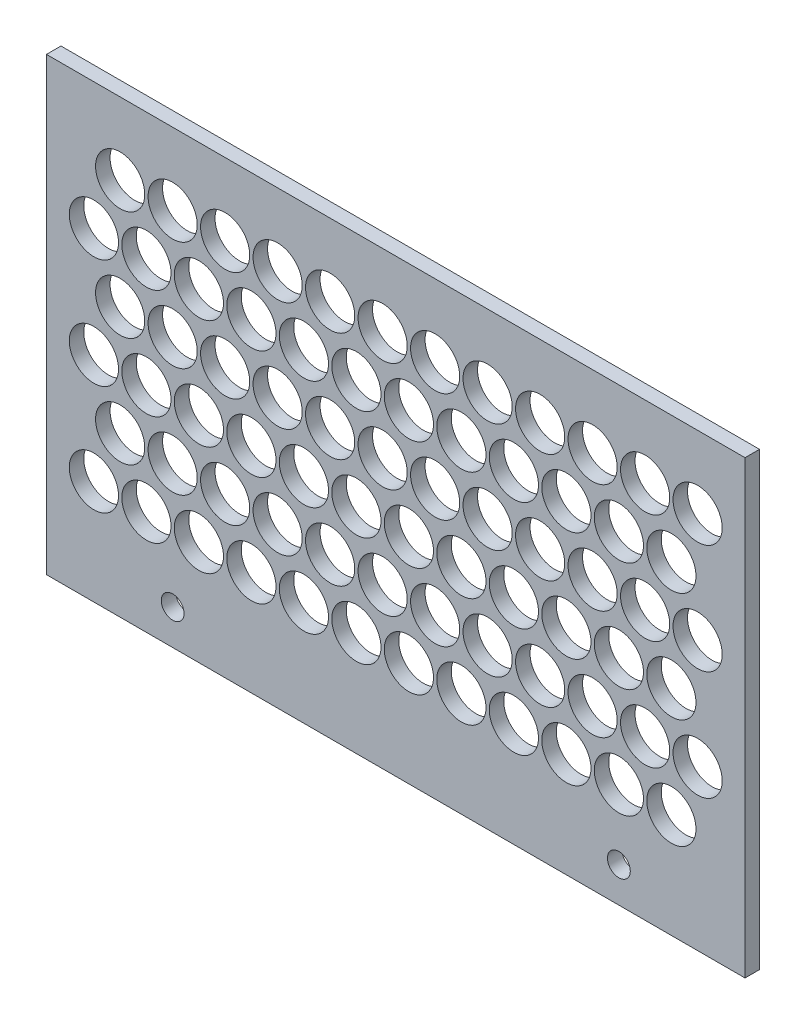
from build123d import *

# Parameters (mm, degrees)
SKETCH1_W                  = 306.05000007
SKETCH1_H                  = 197.4250001
BOSS_EXTRUDE1_DEPTH        = 6.35
CUT_EXTRUDE1_DEPTH         = 187.132543615
SKETCH4_R                  = 10.775
CUT_EXTRUDE2_DEPTH         = 187.132543615
LPATTERN1_COUNT            = 12
LPATTERN1_PITCH            = 23
LPATTERN2_COPY_1_DEPTH     = 187.132543615
LPATTERN2_COPY_2_DEPTH     = 187.132543615
LPATTERN2_COPY_3_DEPTH     = 187.132543615
LPATTERN2_COPY_4_DEPTH     = 187.132543615
LPATTERN2_COPY_5_DEPTH     = 187.132543615
LPATTERN2_COPY_6_DEPTH     = 187.132543615
LPATTERN2_COPY_7_DEPTH     = 187.132543615
LPATTERN2_COPY_8_DEPTH     = 187.132543615
LPATTERN2_COPY_9_DEPTH     = 187.132543615
LPATTERN2_COPY_10_DEPTH    = 187.132543615
LPATTERN2_COPY_11_DEPTH    = 187.132543615
LPATTERN2_COPY_12_DEPTH    = 187.132543615
LPATTERN2_COPY_13_DEPTH    = 187.132543615
LPATTERN2_COPY_14_DEPTH    = 187.132543615
LPATTERN2_COPY_15_DEPTH    = 187.132543615
LPATTERN2_COPY_16_DEPTH    = 187.132543615
LPATTERN2_COPY_17_DEPTH    = 187.132543615
LPATTERN2_COPY_18_DEPTH    = 187.132543615
LPATTERN2_COPY_19_DEPTH    = 187.132543615
LPATTERN2_COPY_20_DEPTH    = 187.132543615
LPATTERN2_COPY_21_DEPTH    = 187.132543615
LPATTERN2_COPY_22_DEPTH    = 187.132543615
LPATTERN2_COPY_23_SKETCH_R = 10.775
LPATTERN2_COPY_23_DEPTH    = 187.132543615
LPATTERN2_COPY_24_SKETCH_R = 10.775
LPATTERN2_COPY_24_DEPTH    = 187.132543615
LPATTERN2_COPY_25_SKETCH_R = 10.775
LPATTERN2_COPY_25_DEPTH    = 187.132543615
LPATTERN2_COPY_26_SKETCH_R = 10.775
LPATTERN2_COPY_26_DEPTH    = 187.132543615
LPATTERN2_COPY_27_SKETCH_R = 10.775
LPATTERN2_COPY_27_DEPTH    = 187.132543615
LPATTERN2_COPY_28_SKETCH_R = 10.775
LPATTERN2_COPY_28_DEPTH    = 187.132543615
LPATTERN2_COPY_29_SKETCH_R = 10.775
LPATTERN2_COPY_29_DEPTH    = 187.132543615
LPATTERN2_COPY_30_SKETCH_R = 10.775
LPATTERN2_COPY_30_DEPTH    = 187.132543615
LPATTERN2_COPY_31_SKETCH_R = 10.775
LPATTERN2_COPY_31_DEPTH    = 187.132543615
LPATTERN2_COPY_32_SKETCH_R = 10.775
LPATTERN2_COPY_32_DEPTH    = 187.132543615
LPATTERN2_COPY_33_SKETCH_R = 10.775
LPATTERN2_COPY_33_DEPTH    = 187.132543615
LPATTERN2_COPY_34_SKETCH_R = 10.775
LPATTERN2_COPY_34_DEPTH    = 187.132543615
LPATTERN2_COPY_35_SKETCH_R = 10.775
LPATTERN2_COPY_35_DEPTH    = 187.132543615
LPATTERN2_COPY_36_SKETCH_R = 10.775
LPATTERN2_COPY_36_DEPTH    = 187.132543615
LPATTERN2_COPY_37_SKETCH_R = 10.775
LPATTERN2_COPY_37_DEPTH    = 187.132543615
LPATTERN2_COPY_38_SKETCH_R = 10.775
LPATTERN2_COPY_38_DEPTH    = 187.132543615
LPATTERN2_COPY_39_SKETCH_R = 10.775
LPATTERN2_COPY_39_DEPTH    = 187.132543615
LPATTERN2_COPY_40_SKETCH_R = 10.775
LPATTERN2_COPY_40_DEPTH    = 187.132543615
LPATTERN2_COPY_41_SKETCH_R = 10.775
LPATTERN2_COPY_41_DEPTH    = 187.132543615
LPATTERN2_COPY_42_SKETCH_R = 10.775
LPATTERN2_COPY_42_DEPTH    = 187.132543615
LPATTERN2_COPY_43_SKETCH_R = 10.775
LPATTERN2_COPY_43_DEPTH    = 187.132543615
LPATTERN2_COPY_44_SKETCH_R = 10.775
LPATTERN2_COPY_44_DEPTH    = 187.132543615
LPATTERN2_COPY_45_DEPTH    = 187.132543615
LPATTERN2_COPY_46_DEPTH    = 187.132543615
LPATTERN2_COPY_47_SKETCH_R = 10.775
LPATTERN2_COPY_47_DEPTH    = 187.132543615
LPATTERN2_COPY_48_SKETCH_R = 10.775
LPATTERN2_COPY_48_DEPTH    = 187.132543615
SKETCH5_R                  = 5
CUT_EXTRUDE3_DEPTH         = 187.132543615


with BuildPart() as part:
    # Sketch1 → Boss-Extrude1 (new body)
    with BuildSketch(Plane.XY):
        with Locations((3.5e-08, -7.06250005)):
            Rectangle(SKETCH1_W, SKETCH1_H)
    extrude(amount=BOSS_EXTRUDE1_DEPTH)

    # Sketch3 → Cut-Extrude1 (cut, through all)
    with BuildSketch(Plane.XY.offset(6.35)):
        with BuildLine():
            ThreePointArc((-121.475, -60), (-132.24999993, -49.225), (-143.025, -59.999999859))
            ThreePointArc((-143.025, -59.999999859), (-139.869075617, -67.619075517), (-132.25, -70.775))
            ThreePointArc((-132.25, -70.775), (-124.630924433, -67.619075567), (-121.475, -60))
        make_face()
    cut_extrude1 = extrude(amount=-CUT_EXTRUDE1_DEPTH, mode=Mode.SUBTRACT)

    # Sketch4 → Cut-Extrude2 (cut, through all)
    with BuildSketch(Plane.XY.offset(6.35)):
        with Locations((-120.75, -36)):
            Circle(SKETCH4_R)
    cut_extrude2 = extrude(amount=-CUT_EXTRUDE2_DEPTH, mode=Mode.SUBTRACT)

    # LPattern1: Cut-Extrude1, Cut-Extrude2 ×12
    with Locations(*[(i * LPATTERN1_PITCH, 0, 0) for i in range(1, LPATTERN1_COUNT)]):
        add(cut_extrude1, mode=Mode.SUBTRACT)
        add(cut_extrude2, mode=Mode.SUBTRACT)

    # LPattern2 copy 1 sketch → LPattern2 copy 1 (cut, through all)
    with BuildSketch(Plane(origin=(23, 48, 6.35), x_dir=(1, 0, 0), z_dir=(0, 0, 1))):
        with BuildLine():
            ThreePointArc((-121.475, -60), (-132.24999993, -49.225), (-143.025, -59.999999859))
            ThreePointArc((-143.025, -59.999999859), (-139.869075617, -67.619075517), (-132.25, -70.775))
            ThreePointArc((-132.25, -70.775), (-124.630924433, -67.619075567), (-121.475, -60))
        make_face()
    extrude(amount=-LPATTERN2_COPY_1_DEPTH, mode=Mode.SUBTRACT)

    # LPattern2 copy 2 sketch → LPattern2 copy 2 (cut, through all)
    with BuildSketch(Plane(origin=(23, 96, 6.35), x_dir=(1, 0, 0), z_dir=(0, 0, 1))):
        with BuildLine():
            ThreePointArc((-121.475, -60), (-132.24999993, -49.225), (-143.025, -59.999999859))
            ThreePointArc((-143.025, -59.999999859), (-139.869075617, -67.619075517), (-132.25, -70.775))
            ThreePointArc((-132.25, -70.775), (-124.630924433, -67.619075567), (-121.475, -60))
        make_face()
    extrude(amount=-LPATTERN2_COPY_2_DEPTH, mode=Mode.SUBTRACT)

    # LPattern2 copy 3 sketch → LPattern2 copy 3 (cut, through all)
    with BuildSketch(Plane(origin=(46, 48, 6.35), x_dir=(1, 0, 0), z_dir=(0, 0, 1))):
        with BuildLine():
            ThreePointArc((-121.475, -60), (-132.24999993, -49.225), (-143.025, -59.999999859))
            ThreePointArc((-143.025, -59.999999859), (-139.869075617, -67.619075517), (-132.25, -70.775))
            ThreePointArc((-132.25, -70.775), (-124.630924433, -67.619075567), (-121.475, -60))
        make_face()
    extrude(amount=-LPATTERN2_COPY_3_DEPTH, mode=Mode.SUBTRACT)

    # LPattern2 copy 4 sketch → LPattern2 copy 4 (cut, through all)
    with BuildSketch(Plane(origin=(46, 96, 6.35), x_dir=(1, 0, 0), z_dir=(0, 0, 1))):
        with BuildLine():
            ThreePointArc((-121.475, -60), (-132.24999993, -49.225), (-143.025, -59.999999859))
            ThreePointArc((-143.025, -59.999999859), (-139.869075617, -67.619075517), (-132.25, -70.775))
            ThreePointArc((-132.25, -70.775), (-124.630924433, -67.619075567), (-121.475, -60))
        make_face()
    extrude(amount=-LPATTERN2_COPY_4_DEPTH, mode=Mode.SUBTRACT)

    # LPattern2 copy 5 sketch → LPattern2 copy 5 (cut, through all)
    with BuildSketch(Plane(origin=(69, 48, 6.35), x_dir=(1, 0, 0), z_dir=(0, 0, 1))):
        with BuildLine():
            ThreePointArc((-121.475, -60), (-132.24999993, -49.225), (-143.025, -59.999999859))
            ThreePointArc((-143.025, -59.999999859), (-139.869075617, -67.619075517), (-132.25, -70.775))
            ThreePointArc((-132.25, -70.775), (-124.630924433, -67.619075567), (-121.475, -60))
        make_face()
    extrude(amount=-LPATTERN2_COPY_5_DEPTH, mode=Mode.SUBTRACT)

    # LPattern2 copy 6 sketch → LPattern2 copy 6 (cut, through all)
    with BuildSketch(Plane(origin=(69, 96, 6.35), x_dir=(1, 0, 0), z_dir=(0, 0, 1))):
        with BuildLine():
            ThreePointArc((-121.475, -60), (-132.24999993, -49.225), (-143.025, -59.999999859))
            ThreePointArc((-143.025, -59.999999859), (-139.869075617, -67.619075517), (-132.25, -70.775))
            ThreePointArc((-132.25, -70.775), (-124.630924433, -67.619075567), (-121.475, -60))
        make_face()
    extrude(amount=-LPATTERN2_COPY_6_DEPTH, mode=Mode.SUBTRACT)

    # LPattern2 copy 7 sketch → LPattern2 copy 7 (cut, through all)
    with BuildSketch(Plane(origin=(92, 48, 6.35), x_dir=(1, 0, 0), z_dir=(0, 0, 1))):
        with BuildLine():
            ThreePointArc((-121.475, -60), (-132.24999993, -49.225), (-143.025, -59.999999859))
            ThreePointArc((-143.025, -59.999999859), (-139.869075617, -67.619075517), (-132.25, -70.775))
            ThreePointArc((-132.25, -70.775), (-124.630924433, -67.619075567), (-121.475, -60))
        make_face()
    extrude(amount=-LPATTERN2_COPY_7_DEPTH, mode=Mode.SUBTRACT)

    # LPattern2 copy 8 sketch → LPattern2 copy 8 (cut, through all)
    with BuildSketch(Plane(origin=(92, 96, 6.35), x_dir=(1, 0, 0), z_dir=(0, 0, 1))):
        with BuildLine():
            ThreePointArc((-121.475, -60), (-132.24999993, -49.225), (-143.025, -59.999999859))
            ThreePointArc((-143.025, -59.999999859), (-139.869075617, -67.619075517), (-132.25, -70.775))
            ThreePointArc((-132.25, -70.775), (-124.630924433, -67.619075567), (-121.475, -60))
        make_face()
    extrude(amount=-LPATTERN2_COPY_8_DEPTH, mode=Mode.SUBTRACT)

    # LPattern2 copy 9 sketch → LPattern2 copy 9 (cut, through all)
    with BuildSketch(Plane(origin=(115, 48, 6.35), x_dir=(1, 0, 0), z_dir=(0, 0, 1))):
        with BuildLine():
            ThreePointArc((-121.475, -60), (-132.24999993, -49.225), (-143.025, -59.999999859))
            ThreePointArc((-143.025, -59.999999859), (-139.869075617, -67.619075517), (-132.25, -70.775))
            ThreePointArc((-132.25, -70.775), (-124.630924433, -67.619075567), (-121.475, -60))
        make_face()
    extrude(amount=-LPATTERN2_COPY_9_DEPTH, mode=Mode.SUBTRACT)

    # LPattern2 copy 10 sketch → LPattern2 copy 10 (cut, through all)
    with BuildSketch(Plane(origin=(115, 96, 6.35), x_dir=(1, 0, 0), z_dir=(0, 0, 1))):
        with BuildLine():
            ThreePointArc((-121.475, -60), (-132.24999993, -49.225), (-143.025, -59.999999859))
            ThreePointArc((-143.025, -59.999999859), (-139.869075617, -67.619075517), (-132.25, -70.775))
            ThreePointArc((-132.25, -70.775), (-124.630924433, -67.619075567), (-121.475, -60))
        make_face()
    extrude(amount=-LPATTERN2_COPY_10_DEPTH, mode=Mode.SUBTRACT)

    # LPattern2 copy 11 sketch → LPattern2 copy 11 (cut, through all)
    with BuildSketch(Plane(origin=(138, 48, 6.35), x_dir=(1, 0, 0), z_dir=(0, 0, 1))):
        with BuildLine():
            ThreePointArc((-121.475, -60), (-132.24999993, -49.225), (-143.025, -59.999999859))
            ThreePointArc((-143.025, -59.999999859), (-139.869075617, -67.619075517), (-132.25, -70.775))
            ThreePointArc((-132.25, -70.775), (-124.630924433, -67.619075567), (-121.475, -60))
        make_face()
    extrude(amount=-LPATTERN2_COPY_11_DEPTH, mode=Mode.SUBTRACT)

    # LPattern2 copy 12 sketch → LPattern2 copy 12 (cut, through all)
    with BuildSketch(Plane(origin=(138, 96, 6.35), x_dir=(1, 0, 0), z_dir=(0, 0, 1))):
        with BuildLine():
            ThreePointArc((-121.475, -60), (-132.24999993, -49.225), (-143.025, -59.999999859))
            ThreePointArc((-143.025, -59.999999859), (-139.869075617, -67.619075517), (-132.25, -70.775))
            ThreePointArc((-132.25, -70.775), (-124.630924433, -67.619075567), (-121.475, -60))
        make_face()
    extrude(amount=-LPATTERN2_COPY_12_DEPTH, mode=Mode.SUBTRACT)

    # LPattern2 copy 13 sketch → LPattern2 copy 13 (cut, through all)
    with BuildSketch(Plane(origin=(161, 48, 6.35), x_dir=(1, 0, 0), z_dir=(0, 0, 1))):
        with BuildLine():
            ThreePointArc((-121.475, -60), (-132.24999993, -49.225), (-143.025, -59.999999859))
            ThreePointArc((-143.025, -59.999999859), (-139.869075617, -67.619075517), (-132.25, -70.775))
            ThreePointArc((-132.25, -70.775), (-124.630924433, -67.619075567), (-121.475, -60))
        make_face()
    extrude(amount=-LPATTERN2_COPY_13_DEPTH, mode=Mode.SUBTRACT)

    # LPattern2 copy 14 sketch → LPattern2 copy 14 (cut, through all)
    with BuildSketch(Plane(origin=(161, 96, 6.35), x_dir=(1, 0, 0), z_dir=(0, 0, 1))):
        with BuildLine():
            ThreePointArc((-121.475, -60), (-132.24999993, -49.225), (-143.025, -59.999999859))
            ThreePointArc((-143.025, -59.999999859), (-139.869075617, -67.619075517), (-132.25, -70.775))
            ThreePointArc((-132.25, -70.775), (-124.630924433, -67.619075567), (-121.475, -60))
        make_face()
    extrude(amount=-LPATTERN2_COPY_14_DEPTH, mode=Mode.SUBTRACT)

    # LPattern2 copy 15 sketch → LPattern2 copy 15 (cut, through all)
    with BuildSketch(Plane(origin=(184, 48, 6.35), x_dir=(1, 0, 0), z_dir=(0, 0, 1))):
        with BuildLine():
            ThreePointArc((-121.475, -60), (-132.24999993, -49.225), (-143.025, -59.999999859))
            ThreePointArc((-143.025, -59.999999859), (-139.869075617, -67.619075517), (-132.25, -70.775))
            ThreePointArc((-132.25, -70.775), (-124.630924433, -67.619075567), (-121.475, -60))
        make_face()
    extrude(amount=-LPATTERN2_COPY_15_DEPTH, mode=Mode.SUBTRACT)

    # LPattern2 copy 16 sketch → LPattern2 copy 16 (cut, through all)
    with BuildSketch(Plane(origin=(184, 96, 6.35), x_dir=(1, 0, 0), z_dir=(0, 0, 1))):
        with BuildLine():
            ThreePointArc((-121.475, -60), (-132.24999993, -49.225), (-143.025, -59.999999859))
            ThreePointArc((-143.025, -59.999999859), (-139.869075617, -67.619075517), (-132.25, -70.775))
            ThreePointArc((-132.25, -70.775), (-124.630924433, -67.619075567), (-121.475, -60))
        make_face()
    extrude(amount=-LPATTERN2_COPY_16_DEPTH, mode=Mode.SUBTRACT)

    # LPattern2 copy 17 sketch → LPattern2 copy 17 (cut, through all)
    with BuildSketch(Plane(origin=(207, 48, 6.35), x_dir=(1, 0, 0), z_dir=(0, 0, 1))):
        with BuildLine():
            ThreePointArc((-121.475, -60), (-132.24999993, -49.225), (-143.025, -59.999999859))
            ThreePointArc((-143.025, -59.999999859), (-139.869075617, -67.619075517), (-132.25, -70.775))
            ThreePointArc((-132.25, -70.775), (-124.630924433, -67.619075567), (-121.475, -60))
        make_face()
    extrude(amount=-LPATTERN2_COPY_17_DEPTH, mode=Mode.SUBTRACT)

    # LPattern2 copy 18 sketch → LPattern2 copy 18 (cut, through all)
    with BuildSketch(Plane(origin=(207, 96, 6.35), x_dir=(1, 0, 0), z_dir=(0, 0, 1))):
        with BuildLine():
            ThreePointArc((-121.475, -60), (-132.24999993, -49.225), (-143.025, -59.999999859))
            ThreePointArc((-143.025, -59.999999859), (-139.869075617, -67.619075517), (-132.25, -70.775))
            ThreePointArc((-132.25, -70.775), (-124.630924433, -67.619075567), (-121.475, -60))
        make_face()
    extrude(amount=-LPATTERN2_COPY_18_DEPTH, mode=Mode.SUBTRACT)

    # LPattern2 copy 19 sketch → LPattern2 copy 19 (cut, through all)
    with BuildSketch(Plane(origin=(230, 48, 6.35), x_dir=(1, 0, 0), z_dir=(0, 0, 1))):
        with BuildLine():
            ThreePointArc((-121.475, -60), (-132.24999993, -49.225), (-143.025, -59.999999859))
            ThreePointArc((-143.025, -59.999999859), (-139.869075617, -67.619075517), (-132.25, -70.775))
            ThreePointArc((-132.25, -70.775), (-124.630924433, -67.619075567), (-121.475, -60))
        make_face()
    extrude(amount=-LPATTERN2_COPY_19_DEPTH, mode=Mode.SUBTRACT)

    # LPattern2 copy 20 sketch → LPattern2 copy 20 (cut, through all)
    with BuildSketch(Plane(origin=(230, 96, 6.35), x_dir=(1, 0, 0), z_dir=(0, 0, 1))):
        with BuildLine():
            ThreePointArc((-121.475, -60), (-132.24999993, -49.225), (-143.025, -59.999999859))
            ThreePointArc((-143.025, -59.999999859), (-139.869075617, -67.619075517), (-132.25, -70.775))
            ThreePointArc((-132.25, -70.775), (-124.630924433, -67.619075567), (-121.475, -60))
        make_face()
    extrude(amount=-LPATTERN2_COPY_20_DEPTH, mode=Mode.SUBTRACT)

    # LPattern2 copy 21 sketch → LPattern2 copy 21 (cut, through all)
    with BuildSketch(Plane(origin=(253, 48, 6.35), x_dir=(1, 0, 0), z_dir=(0, 0, 1))):
        with BuildLine():
            ThreePointArc((-121.475, -60), (-132.24999993, -49.225), (-143.025, -59.999999859))
            ThreePointArc((-143.025, -59.999999859), (-139.869075617, -67.619075517), (-132.25, -70.775))
            ThreePointArc((-132.25, -70.775), (-124.630924433, -67.619075567), (-121.475, -60))
        make_face()
    extrude(amount=-LPATTERN2_COPY_21_DEPTH, mode=Mode.SUBTRACT)

    # LPattern2 copy 22 sketch → LPattern2 copy 22 (cut, through all)
    with BuildSketch(Plane(origin=(253, 96, 6.35), x_dir=(1, 0, 0), z_dir=(0, 0, 1))):
        with BuildLine():
            ThreePointArc((-121.475, -60), (-132.24999993, -49.225), (-143.025, -59.999999859))
            ThreePointArc((-143.025, -59.999999859), (-139.869075617, -67.619075517), (-132.25, -70.775))
            ThreePointArc((-132.25, -70.775), (-124.630924433, -67.619075567), (-121.475, -60))
        make_face()
    extrude(amount=-LPATTERN2_COPY_22_DEPTH, mode=Mode.SUBTRACT)

    # LPattern2 copy 23 sketch → LPattern2 copy 23 (cut, through all)
    with BuildSketch(Plane(origin=(23, 48, 6.35), x_dir=(1, 0, 0), z_dir=(0, 0, 1))):
        with Locations((-120.75, -36)):
            Circle(LPATTERN2_COPY_23_SKETCH_R)
    extrude(amount=-LPATTERN2_COPY_23_DEPTH, mode=Mode.SUBTRACT)

    # LPattern2 copy 24 sketch → LPattern2 copy 24 (cut, through all)
    with BuildSketch(Plane(origin=(23, 96, 6.35), x_dir=(1, 0, 0), z_dir=(0, 0, 1))):
        with Locations((-120.75, -36)):
            Circle(LPATTERN2_COPY_24_SKETCH_R)
    extrude(amount=-LPATTERN2_COPY_24_DEPTH, mode=Mode.SUBTRACT)

    # LPattern2 copy 25 sketch → LPattern2 copy 25 (cut, through all)
    with BuildSketch(Plane(origin=(46, 48, 6.35), x_dir=(1, 0, 0), z_dir=(0, 0, 1))):
        with Locations((-120.75, -36)):
            Circle(LPATTERN2_COPY_25_SKETCH_R)
    extrude(amount=-LPATTERN2_COPY_25_DEPTH, mode=Mode.SUBTRACT)

    # LPattern2 copy 26 sketch → LPattern2 copy 26 (cut, through all)
    with BuildSketch(Plane(origin=(46, 96, 6.35), x_dir=(1, 0, 0), z_dir=(0, 0, 1))):
        with Locations((-120.75, -36)):
            Circle(LPATTERN2_COPY_26_SKETCH_R)
    extrude(amount=-LPATTERN2_COPY_26_DEPTH, mode=Mode.SUBTRACT)

    # LPattern2 copy 27 sketch → LPattern2 copy 27 (cut, through all)
    with BuildSketch(Plane(origin=(69, 48, 6.35), x_dir=(1, 0, 0), z_dir=(0, 0, 1))):
        with Locations((-120.75, -36)):
            Circle(LPATTERN2_COPY_27_SKETCH_R)
    extrude(amount=-LPATTERN2_COPY_27_DEPTH, mode=Mode.SUBTRACT)

    # LPattern2 copy 28 sketch → LPattern2 copy 28 (cut, through all)
    with BuildSketch(Plane(origin=(69, 96, 6.35), x_dir=(1, 0, 0), z_dir=(0, 0, 1))):
        with Locations((-120.75, -36)):
            Circle(LPATTERN2_COPY_28_SKETCH_R)
    extrude(amount=-LPATTERN2_COPY_28_DEPTH, mode=Mode.SUBTRACT)

    # LPattern2 copy 29 sketch → LPattern2 copy 29 (cut, through all)
    with BuildSketch(Plane(origin=(92, 48, 6.35), x_dir=(1, 0, 0), z_dir=(0, 0, 1))):
        with Locations((-120.75, -36)):
            Circle(LPATTERN2_COPY_29_SKETCH_R)
    extrude(amount=-LPATTERN2_COPY_29_DEPTH, mode=Mode.SUBTRACT)

    # LPattern2 copy 30 sketch → LPattern2 copy 30 (cut, through all)
    with BuildSketch(Plane(origin=(92, 96, 6.35), x_dir=(1, 0, 0), z_dir=(0, 0, 1))):
        with Locations((-120.75, -36)):
            Circle(LPATTERN2_COPY_30_SKETCH_R)
    extrude(amount=-LPATTERN2_COPY_30_DEPTH, mode=Mode.SUBTRACT)

    # LPattern2 copy 31 sketch → LPattern2 copy 31 (cut, through all)
    with BuildSketch(Plane(origin=(115, 48, 6.35), x_dir=(1, 0, 0), z_dir=(0, 0, 1))):
        with Locations((-120.75, -36)):
            Circle(LPATTERN2_COPY_31_SKETCH_R)
    extrude(amount=-LPATTERN2_COPY_31_DEPTH, mode=Mode.SUBTRACT)

    # LPattern2 copy 32 sketch → LPattern2 copy 32 (cut, through all)
    with BuildSketch(Plane(origin=(115, 96, 6.35), x_dir=(1, 0, 0), z_dir=(0, 0, 1))):
        with Locations((-120.75, -36)):
            Circle(LPATTERN2_COPY_32_SKETCH_R)
    extrude(amount=-LPATTERN2_COPY_32_DEPTH, mode=Mode.SUBTRACT)

    # LPattern2 copy 33 sketch → LPattern2 copy 33 (cut, through all)
    with BuildSketch(Plane(origin=(138, 48, 6.35), x_dir=(1, 0, 0), z_dir=(0, 0, 1))):
        with Locations((-120.75, -36)):
            Circle(LPATTERN2_COPY_33_SKETCH_R)
    extrude(amount=-LPATTERN2_COPY_33_DEPTH, mode=Mode.SUBTRACT)

    # LPattern2 copy 34 sketch → LPattern2 copy 34 (cut, through all)
    with BuildSketch(Plane(origin=(138, 96, 6.35), x_dir=(1, 0, 0), z_dir=(0, 0, 1))):
        with Locations((-120.75, -36)):
            Circle(LPATTERN2_COPY_34_SKETCH_R)
    extrude(amount=-LPATTERN2_COPY_34_DEPTH, mode=Mode.SUBTRACT)

    # LPattern2 copy 35 sketch → LPattern2 copy 35 (cut, through all)
    with BuildSketch(Plane(origin=(161, 48, 6.35), x_dir=(1, 0, 0), z_dir=(0, 0, 1))):
        with Locations((-120.75, -36)):
            Circle(LPATTERN2_COPY_35_SKETCH_R)
    extrude(amount=-LPATTERN2_COPY_35_DEPTH, mode=Mode.SUBTRACT)

    # LPattern2 copy 36 sketch → LPattern2 copy 36 (cut, through all)
    with BuildSketch(Plane(origin=(161, 96, 6.35), x_dir=(1, 0, 0), z_dir=(0, 0, 1))):
        with Locations((-120.75, -36)):
            Circle(LPATTERN2_COPY_36_SKETCH_R)
    extrude(amount=-LPATTERN2_COPY_36_DEPTH, mode=Mode.SUBTRACT)

    # LPattern2 copy 37 sketch → LPattern2 copy 37 (cut, through all)
    with BuildSketch(Plane(origin=(184, 48, 6.35), x_dir=(1, 0, 0), z_dir=(0, 0, 1))):
        with Locations((-120.75, -36)):
            Circle(LPATTERN2_COPY_37_SKETCH_R)
    extrude(amount=-LPATTERN2_COPY_37_DEPTH, mode=Mode.SUBTRACT)

    # LPattern2 copy 38 sketch → LPattern2 copy 38 (cut, through all)
    with BuildSketch(Plane(origin=(184, 96, 6.35), x_dir=(1, 0, 0), z_dir=(0, 0, 1))):
        with Locations((-120.75, -36)):
            Circle(LPATTERN2_COPY_38_SKETCH_R)
    extrude(amount=-LPATTERN2_COPY_38_DEPTH, mode=Mode.SUBTRACT)

    # LPattern2 copy 39 sketch → LPattern2 copy 39 (cut, through all)
    with BuildSketch(Plane(origin=(207, 48, 6.35), x_dir=(1, 0, 0), z_dir=(0, 0, 1))):
        with Locations((-120.75, -36)):
            Circle(LPATTERN2_COPY_39_SKETCH_R)
    extrude(amount=-LPATTERN2_COPY_39_DEPTH, mode=Mode.SUBTRACT)

    # LPattern2 copy 40 sketch → LPattern2 copy 40 (cut, through all)
    with BuildSketch(Plane(origin=(207, 96, 6.35), x_dir=(1, 0, 0), z_dir=(0, 0, 1))):
        with Locations((-120.75, -36)):
            Circle(LPATTERN2_COPY_40_SKETCH_R)
    extrude(amount=-LPATTERN2_COPY_40_DEPTH, mode=Mode.SUBTRACT)

    # LPattern2 copy 41 sketch → LPattern2 copy 41 (cut, through all)
    with BuildSketch(Plane(origin=(230, 48, 6.35), x_dir=(1, 0, 0), z_dir=(0, 0, 1))):
        with Locations((-120.75, -36)):
            Circle(LPATTERN2_COPY_41_SKETCH_R)
    extrude(amount=-LPATTERN2_COPY_41_DEPTH, mode=Mode.SUBTRACT)

    # LPattern2 copy 42 sketch → LPattern2 copy 42 (cut, through all)
    with BuildSketch(Plane(origin=(230, 96, 6.35), x_dir=(1, 0, 0), z_dir=(0, 0, 1))):
        with Locations((-120.75, -36)):
            Circle(LPATTERN2_COPY_42_SKETCH_R)
    extrude(amount=-LPATTERN2_COPY_42_DEPTH, mode=Mode.SUBTRACT)

    # LPattern2 copy 43 sketch → LPattern2 copy 43 (cut, through all)
    with BuildSketch(Plane(origin=(253, 48, 6.35), x_dir=(1, 0, 0), z_dir=(0, 0, 1))):
        with Locations((-120.75, -36)):
            Circle(LPATTERN2_COPY_43_SKETCH_R)
    extrude(amount=-LPATTERN2_COPY_43_DEPTH, mode=Mode.SUBTRACT)

    # LPattern2 copy 44 sketch → LPattern2 copy 44 (cut, through all)
    with BuildSketch(Plane(origin=(253, 96, 6.35), x_dir=(1, 0, 0), z_dir=(0, 0, 1))):
        with Locations((-120.75, -36)):
            Circle(LPATTERN2_COPY_44_SKETCH_R)
    extrude(amount=-LPATTERN2_COPY_44_DEPTH, mode=Mode.SUBTRACT)

    # LPattern2 copy 45 sketch → LPattern2 copy 45 (cut, through all)
    with BuildSketch(Plane(origin=(0, 48, 6.35), x_dir=(1, 0, 0), z_dir=(0, 0, 1))):
        with BuildLine():
            ThreePointArc((-121.475, -60), (-132.24999993, -49.225), (-143.025, -59.999999859))
            ThreePointArc((-143.025, -59.999999859), (-139.869075617, -67.619075517), (-132.25, -70.775))
            ThreePointArc((-132.25, -70.775), (-124.630924433, -67.619075567), (-121.475, -60))
        make_face()
    extrude(amount=-LPATTERN2_COPY_45_DEPTH, mode=Mode.SUBTRACT)

    # LPattern2 copy 46 sketch → LPattern2 copy 46 (cut, through all)
    with BuildSketch(Plane(origin=(0, 96, 6.35), x_dir=(1, 0, 0), z_dir=(0, 0, 1))):
        with BuildLine():
            ThreePointArc((-121.475, -60), (-132.24999993, -49.225), (-143.025, -59.999999859))
            ThreePointArc((-143.025, -59.999999859), (-139.869075617, -67.619075517), (-132.25, -70.775))
            ThreePointArc((-132.25, -70.775), (-124.630924433, -67.619075567), (-121.475, -60))
        make_face()
    extrude(amount=-LPATTERN2_COPY_46_DEPTH, mode=Mode.SUBTRACT)

    # LPattern2 copy 47 sketch → LPattern2 copy 47 (cut, through all)
    with BuildSketch(Plane(origin=(0, 48, 6.35), x_dir=(1, 0, 0), z_dir=(0, 0, 1))):
        with Locations((-120.75, -36)):
            Circle(LPATTERN2_COPY_47_SKETCH_R)
    extrude(amount=-LPATTERN2_COPY_47_DEPTH, mode=Mode.SUBTRACT)

    # LPattern2 copy 48 sketch → LPattern2 copy 48 (cut, through all)
    with BuildSketch(Plane(origin=(0, 96, 6.35), x_dir=(1, 0, 0), z_dir=(0, 0, 1))):
        with Locations((-120.75, -36)):
            Circle(LPATTERN2_COPY_48_SKETCH_R)
    extrude(amount=-LPATTERN2_COPY_48_DEPTH, mode=Mode.SUBTRACT)

    # Sketch5 → Cut-Extrude3 (cut, through all)
    with BuildSketch(Plane(origin=(0, 0, 0), x_dir=(-1, 0, 0), z_dir=(0, 0, -1))):
        with Locations((-97.75, -90.3965)):
            Circle(SKETCH5_R)
    cut_extrude3 = extrude(amount=-CUT_EXTRUDE3_DEPTH, mode=Mode.SUBTRACT)

    # Mirror1: Cut-Extrude3 across plane
    add(cut_extrude3.mirror(Plane(origin=(0, 0, 0), x_dir=(0, 0, 1), z_dir=(1, 0, 0))), mode=Mode.SUBTRACT)


solid = part.part
